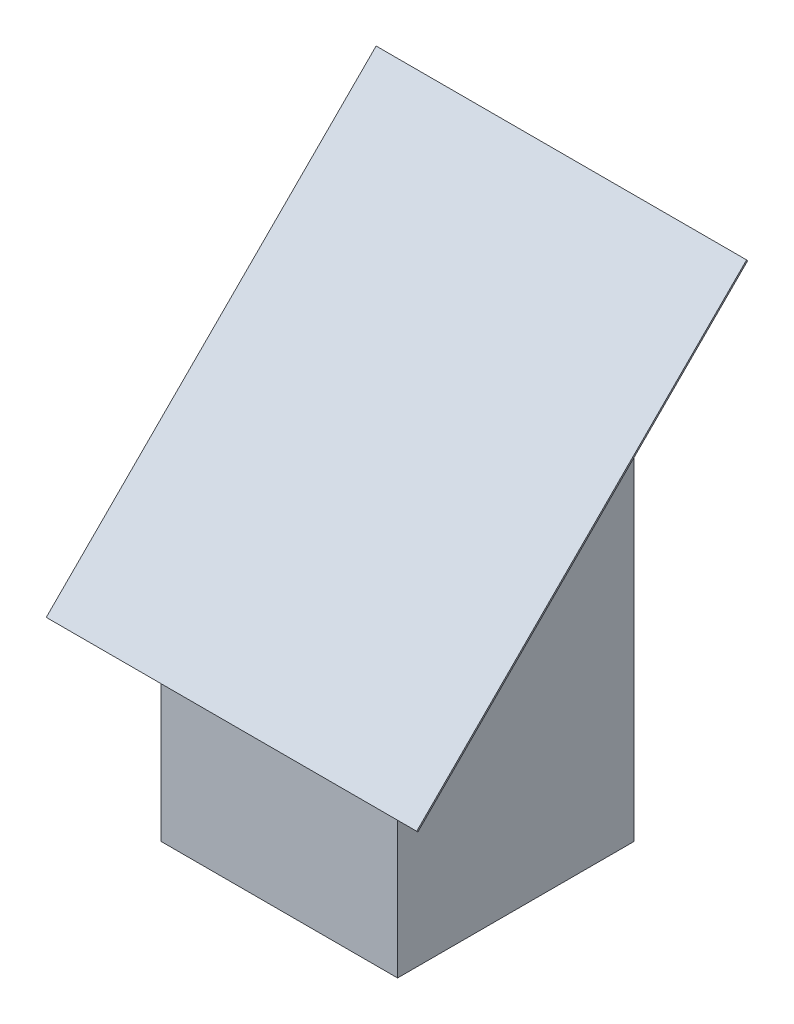
from build123d import *

# Parameters (mm, degrees)
CROQUIS1_W              = 86.2
CROQUIS1_H              = 86.2
CROQUIS1_W_2            = 85
CROQUIS1_H_2            = 85
SALIENTE_EXTRUIR1_DEPTH = 170
CORTAR_EXTRUIR1_DEPTH   = 209.944490236
CROQUIS3_W              = 135
CROQUIS3_H              = 170
SALIENTE_EXTRUIR2_DEPTH = 0.6


with BuildPart() as part:
    # Croquis1 → Saliente-Extruir1 (new body)
    with BuildSketch(Plane(origin=(0, 0, 0), x_dir=(1, 0, 0), z_dir=(0, 1, 0))):
        with Locations((42.5, 42.5)):
            Rectangle(CROQUIS1_W, CROQUIS1_H)
        with Locations((42.5, 42.5)):
            Rectangle(CROQUIS1_W_2, CROQUIS1_H_2, mode=Mode.SUBTRACT)
    extrude(amount=SALIENTE_EXTRUIR1_DEPTH)

    # Croquis2 → Cortar-Extruir1 (cut, through all)
    with BuildSketch(Plane(origin=(85.6, 0, 0), x_dir=(0, 0, -1), z_dir=(1, 0, 0))):
        Polygon((85.6, 170), (-0.6, 83.8), (-0.6, 170), align=None)
    extrude(amount=-CORTAR_EXTRUIR1_DEPTH, mode=Mode.SUBTRACT)

    # Croquis3 → Saliente-Extruir2 (add)
    with BuildSketch(Plane(origin=(0, 42.2, 42.2), x_dir=(1, 0, 0), z_dir=(0, 0.7071067811865436, 0.7071067811865515))):
        with Locations((42.5, 119.783888733)):
            Rectangle(CROQUIS3_W, CROQUIS3_H)
    extrude(amount=SALIENTE_EXTRUIR2_DEPTH)


solid = part.part
